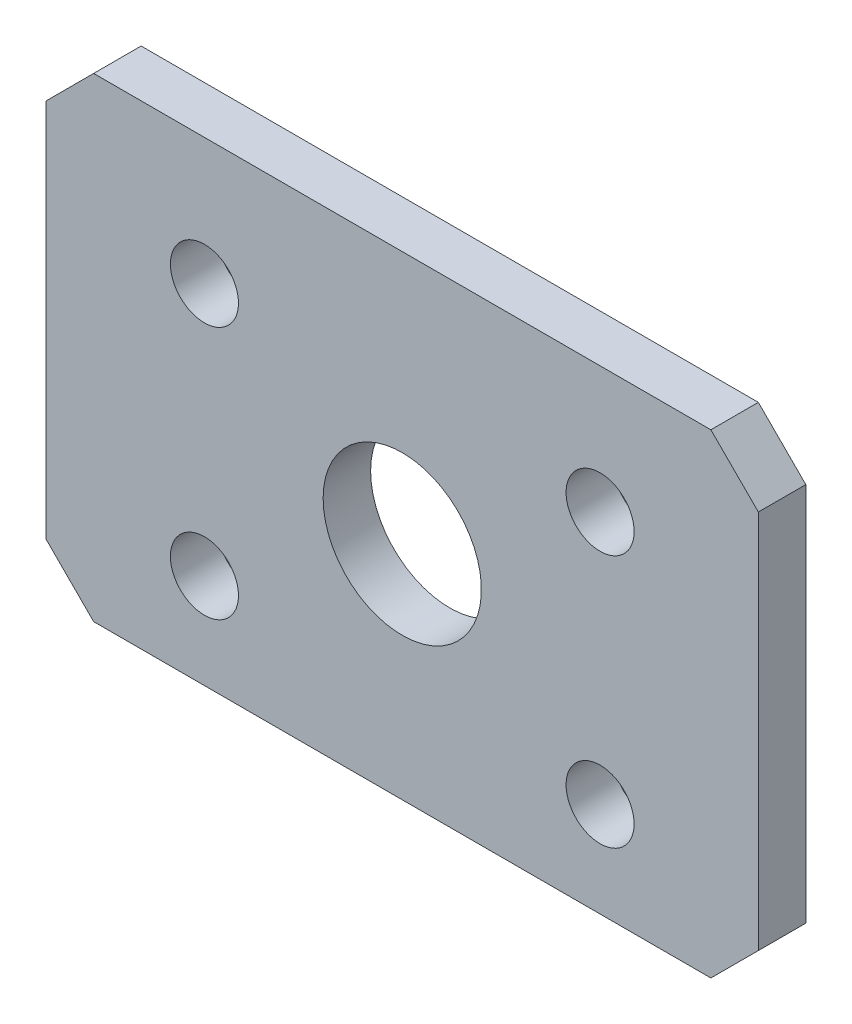
from build123d import *

# Parameters (mm, degrees)
SKETCH_1_W               = 33
SKETCH_1_H               = 47
SKETCH_1_R               = 5
EXTRUDE_1_DEPTH          = 4
EXTRUDE_2_DEPTH          = 30
SKETCH_4_W               = 33
SKETCH_4_H               = 38
EXTRUDE_3_DEPTH          = 4
CHAMFER_1_SIZE           = 3
SKETCH_5_W               = 10
SKETCH_5_H               = 30
EXTRUDE_4_DEPTH          = 6
SKETCH_6_R               = 2.15
CUT_EXTRUDE_1_DEPTH      = 88.143559716
SKETCH_7_R               = 2.15
CUT_EXTRUDE_2_DEPTH      = 60
SKETCH_8_W               = 142.872393379
SKETCH_8_H               = 129.651084076
CUT_EXTRUDE_3_DEPTH      = 88.143559716
CUT_EXTRUDE_START        = -26
SKETCH_9_W               = 6
SKETCH_9_H               = 85
SKETCH_9_H_2             = 55
CUT_EXTRUDE_4_DEPTH      = 26
SKETCH_10_R              = 6.65
EXTRUDE_5_DEPTH          = 5.2
EXTRUDE_6_DEPTH          = 6
CHAMFER_2_SIZE           = 5.2
EXTRUDE_START            = -6
SKETCH_12_R              = 2.15
EXTRUDE_7_DEPTH          = 6
SKETCH_13_R              = 2.15
CUT_EXTRUDE_5_DEPTH      = 110.424128966
CUT_EXTRUDE_6_DEPTH      = 110.424128966
CUT_EXTRUDE_6_DEPTH_BACK = 110.424128966
SKETCH_14_W              = 45
SKETCH_14_H              = 81.938700875
SKETCH_15_W              = 48.923705392
SKETCH_15_H              = 34.943280138
CUT_EXTRUDE_7_DEPTH      = 6.2
CHAMFER_3_SIZE           = 3


with BuildPart() as part:
    # 草图1 → 凸台-拉伸1 (new body)
    with BuildSketch(Plane.XY):
        with Locations((16.5, 23.5)):
            Rectangle(SKETCH_1_W, SKETCH_1_H)
        with Locations((16.5, 31)):
            Circle(SKETCH_1_R, mode=Mode.SUBTRACT)
    extrude(amount=EXTRUDE_1_DEPTH)

    # 草图3 → 凸台-拉伸2 (add)
    with BuildSketch(Plane(origin=(0, 0, 0), x_dir=(-1, 0, 0), z_dir=(0, 0, -1))):
        Polygon((0, -38), (-33, -38), (-33, 47), (-39, 47), (-39, -63), (-26.75, -63), (-26.75, -43), (-6.25, -43), (-6.25, -63), (6, -63), (6, 47), (0, 47), align=None)
    extrude(amount=-EXTRUDE_2_DEPTH)

    # 草图4 → 凸台-拉伸3 (add)
    with BuildSketch(Plane(origin=(0, 0, 0), x_dir=(-1, 0, 0), z_dir=(0, 0, -1))):
        with Locations((-16.5, -19)):
            Rectangle(SKETCH_4_W, SKETCH_4_H)
    extrude(amount=-EXTRUDE_3_DEPTH)

    # 倒角1
    chamfer_1_edges = [part.edges().sort_by_distance(p)[0] for p in [
        (-6, 47, 15),
        (-6, -63, 15),
        (39, -63, 15),
        (39, 47, 15),
    ]]
    chamfer(chamfer_1_edges, length=CHAMFER_1_SIZE)

    # 草图5 → 凸台-拉伸4 (add)
    with BuildSketch(Plane(origin=(39, 0, 0), x_dir=(0, 0, -1), z_dir=(1, 0, 0))):
        with Locations((-35, -23)):
            Rectangle(SKETCH_5_W, SKETCH_5_H)
    extrude(amount=-EXTRUDE_4_DEPTH)

    # 草图6 → 切除-拉伸1 (cut, through all)
    with BuildSketch(Plane(origin=(39, 0, 0), x_dir=(0, 0, -1), z_dir=(1, 0, 0))):
        with Locations(Location((-11, -32, 0), (0, 0, 90))):
            Circle(SKETCH_6_R)
        with Locations(Location((-35, -32, 0), (0, 0, 90))):
            Circle(SKETCH_6_R)
        with Locations(Location((-11, -14, 0), (0, 0, 90))):
            Circle(SKETCH_6_R)
        with Locations(Location((-35, -14, 0), (0, 0, 90))):
            Circle(SKETCH_6_R)
    extrude(amount=-CUT_EXTRUDE_1_DEPTH, mode=Mode.SUBTRACT)

    # 草图7 → 切除-拉伸2 (cut)
    with BuildSketch(Plane.ZY.offset(6)):
        with Locations(Location((15, -53, 0), (0, 0, 270))):
            Circle(SKETCH_7_R)
    extrude(amount=-CUT_EXTRUDE_2_DEPTH, mode=Mode.SUBTRACT)

    # 镜向1: part across plane


with BuildPart() as part_1:
    add(part.part)
    add(part.part.mirror(Plane(origin=(39, 0, 0), x_dir=(0, 0, 1), z_dir=(1, 0, 0))))

    # 草图8 → 切除-拉伸3 (cut, through all)
    with BuildSketch(Plane(origin=(39, 0, 0), x_dir=(0, 0, -1), z_dir=(1, 0, 0))):
        with Locations((-14.281868294, -7.269848701)):
            Rectangle(SKETCH_8_W, SKETCH_8_H)
    extrude(amount=-CUT_EXTRUDE_3_DEPTH, mode=Mode.SUBTRACT)

    # 草图9 → 切除-拉伸4 (cut)
    with BuildSketch(Plane.XY.offset(30).offset(CUT_EXTRUDE_START)):
        with Locations((81, 4.5)):
            Rectangle(SKETCH_9_W, SKETCH_9_H)
        with Locations((42, 19.5)):
            Rectangle(SKETCH_9_W, SKETCH_9_H_2)
    extrude(amount=CUT_EXTRUDE_4_DEPTH, mode=Mode.SUBTRACT)

    # 草图10 → 凸台-拉伸5 (add)
    with BuildSketch(Plane.XY.offset(4)):
        Polygon((42, 47), (39, 44), (39, 17), (84, 17), (84, 44), (81, 47), align=None)
        with Locations((61.5, 31)):
            Circle(SKETCH_10_R, mode=Mode.SUBTRACT)
    extrude(amount=EXTRUDE_5_DEPTH)

    # 草图11 → 凸台-拉伸6 (add)
    with BuildSketch(Plane.ZY.offset(-39)):
        Polygon((40, -8), (4, -8), (4, 17), (9.2, 17), align=None)
    extrude(amount=-EXTRUDE_6_DEPTH)

    # 倒角2
    chamfer_2_edges = [part_1.edges().sort_by_distance(p)[0] for p in [
        (64.5, 17, 4),
    ]]
    chamfer(chamfer_2_edges, length=CHAMFER_2_SIZE - 0.0001)  # a hair under: the kernel refuses the full size

    # 草图12 → 凸台-拉伸7 (add)
    with BuildSketch(Plane(origin=(84, 0, 0), x_dir=(0, 0, -1), z_dir=(1, 0, 0)).offset(EXTRUDE_START)):
        Polygon((-30, -38), (-4, -38), (-4, -13), align=None)
        with Locations(Location((-11, -32, 0), (0, 0, 90))):
            Circle(SKETCH_12_R, mode=Mode.SUBTRACT)
    extrude(amount=EXTRUDE_7_DEPTH)

    # 草图13 → 切除-拉伸5 (cut, through all)
    with BuildSketch(Plane.XY.offset(9.2)):
        with Locations((49, 39)):
            Circle(SKETCH_13_R)
        with Locations((49, 23)):
            Circle(SKETCH_13_R)
        with Locations((74, 39)):
            Circle(SKETCH_13_R)
        with Locations((74, 23)):
            Circle(SKETCH_13_R)
    extrude(amount=-CUT_EXTRUDE_5_DEPTH, mode=Mode.SUBTRACT)

    # 草图14 → 切除-拉伸6 (cut, two sides: drawn at the far end of the back side and taken through both)
    with BuildSketch(Plane.XY.offset(9.2).offset(-CUT_EXTRUDE_6_DEPTH_BACK)):
        with Locations((61.5, -23.969350438)):
            Rectangle(SKETCH_14_W, SKETCH_14_H)
    extrude(amount=CUT_EXTRUDE_6_DEPTH + CUT_EXTRUDE_6_DEPTH_BACK, mode=Mode.SUBTRACT)

    # 草图15 → 切除-拉伸7 (cut)
    with BuildSketch(Plane.XY.offset(9.2)):
        with Locations((63.461852696, 34.471640069)):
            Rectangle(SKETCH_15_W, SKETCH_15_H)
    extrude(amount=-CUT_EXTRUDE_7_DEPTH, mode=Mode.SUBTRACT)

    # 倒角3
    chamfer_3_edges = [part_1.edges().sort_by_distance(p)[0] for p in [
        (84, 17, 1.5),
        (39, 17, 1.5),
    ]]
    chamfer(chamfer_3_edges, length=CHAMFER_3_SIZE)


solid = part_1.part
